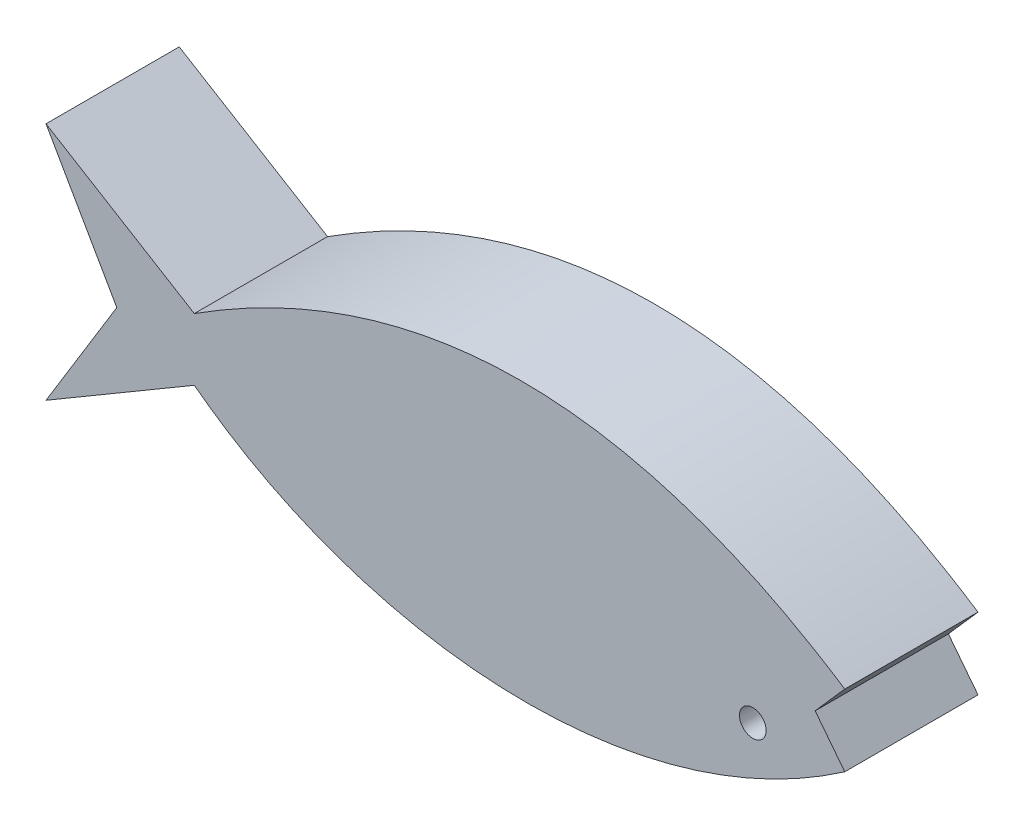
from build123d import *

# Parameters (mm, degrees)
SKETCH2_R           = 0.500109693
BOSS_EXTRUDE1_DEPTH = 5
BOSS_EXTRUDE2_DEPTH = 1


with BuildPart() as part:
    # Sketch2 → Boss-Extrude1 (new body)
    with BuildSketch(Plane(origin=(0, 0, 0), x_dir=(1, 0, 0), z_dir=(0, 0, -1))):
        with BuildLine():
            Line((29.97295835, 6.642737104), (28.862437793, 5.215722686))
            Line((28.862437793, 5.215722686), (29.97295835, 3.953817374))
            add(Edge.make_bspline(
                [(5.565346412, 3.953817374), (17.919076804, -3.939717318), (29.97295835, 3.953817374)],
                knots=[0, 0, 0, 1, 1, 1], degree=2))
            Line((5.565346412, 3.953817374), (0, 0.570103483))
            Line((0, 0.570103483), (2.65645961, 5.215722686))
            Line((2.65645961, 5.215722686), (0, 9.556126627))
            Line((0, 9.556126627), (5.565346412, 6.285726684))
            add(Edge.make_bspline(
                [(5.565346412, 6.285726684), (12.037313538, 11.217277608), (22.14175538, 12.07873787), (29.97295835, 6.642737104)],
                knots=[0, 0, 0, 0, 1, 1, 1, 1], degree=3))
        make_face()
        with Locations((26.5225963, 6.780666166)):
            Circle(SKETCH2_R, mode=Mode.SUBTRACT)
    extrude(amount=BOSS_EXTRUDE1_DEPTH)

    # Sketch6 → Boss-Extrude2 (add)
    with BuildSketch(Plane(origin=(0, 0, -5), x_dir=(1, 0, 0), z_dir=(0, 0, -1))):
        with BuildLine():
            Line((15.397925159, 9.010764846), (15.714323847, 6.434711925))
            add(Edge.make_bspline(
                [(15.714323847, 6.434711925), (15.097356462, 6.367007789), (14.379395634, 6.191327648), (14.288909321, 5.236677342)],
                knots=[0, 0, 0, 0, 1, 1, 1, 1], degree=3))
            add(Edge.make_bspline(
                [(14.288909321, 5.236677342), (14.257707404, 4.567596914), (14.808256448, 4.014737461), (15.870578706, 3.9972817)],
                knots=[0, 0, 0, 0, 1, 1, 1, 1], degree=3))
            add(Edge.make_bspline(
                [(15.870578706, 3.9972817), (16.643663938, 3.917876438), (17.41859565, 4.559822032), (16.956167459, 6.060577801)],
                knots=[0, 0, 0, 0, 1, 1, 1, 1], degree=3))
            Line((16.956167459, 6.060577801), (18.723875117, 5.947079846))
            add(Edge.make_bspline(
                [(18.723875117, 5.947079846), (18.694594218, 5.432522565), (18.896678971, 3.990673564), (20.307895087, 4.518281379)],
                knots=[0, 0, 0, 0, 1, 1, 1, 1], degree=3))
            add(Edge.make_bspline(
                [(20.307895087, 4.518281379), (21.12482019, 4.971825502), (20.80072729, 6.546399181), (19.522800813, 6.434711925)],
                knots=[0, 0, 0, 0, 1, 1, 1, 1], degree=3))
            Line((19.522800813, 6.434711925), (19.965954788, 8.899956857))
            add(Edge.make_bspline(
                [(22.42615025, 5.024825919), (22.602312395, 7.092573652), (21.588282743, 8.451707482), (19.965954788, 8.899956857)],
                knots=[0, 0, 0, 0, 1, 1, 1, 1], degree=3))
            add(Edge.make_bspline(
                [(18.11334991, 3.091587951), (18.887797147, 1.327927695), (22.147754688, 1.000428108), (22.42615025, 5.024825919)],
                knots=[0, 0, 0, 0, 1, 1, 1, 1], degree=3))
            add(Edge.make_bspline(
                [(15.714323847, 1.363350457), (17.371898677, 1.236251334), (18.11334991, 3.091587951)],
                knots=[0, 0, 0, 1, 1, 1], degree=2))
            add(Edge.make_bspline(
                [(12.762146904, 5.024825919), (12.812073914, 3.4578289), (13.882886435, 1.412404889), (15.714323847, 1.363350457)],
                knots=[0, 0, 0, 0, 1, 1, 1, 1], degree=3))
            add(Edge.make_bspline(
                [(15.397925159, 9.010764846), (12.959878536, 8.540272501), (12.691956612, 6.001008164), (12.762146904, 5.024825919)],
                knots=[0, 0, 0, 0, 1, 1, 1, 1], degree=3))
        make_face()
    extrude(amount=BOSS_EXTRUDE2_DEPTH)


solid = part.part
